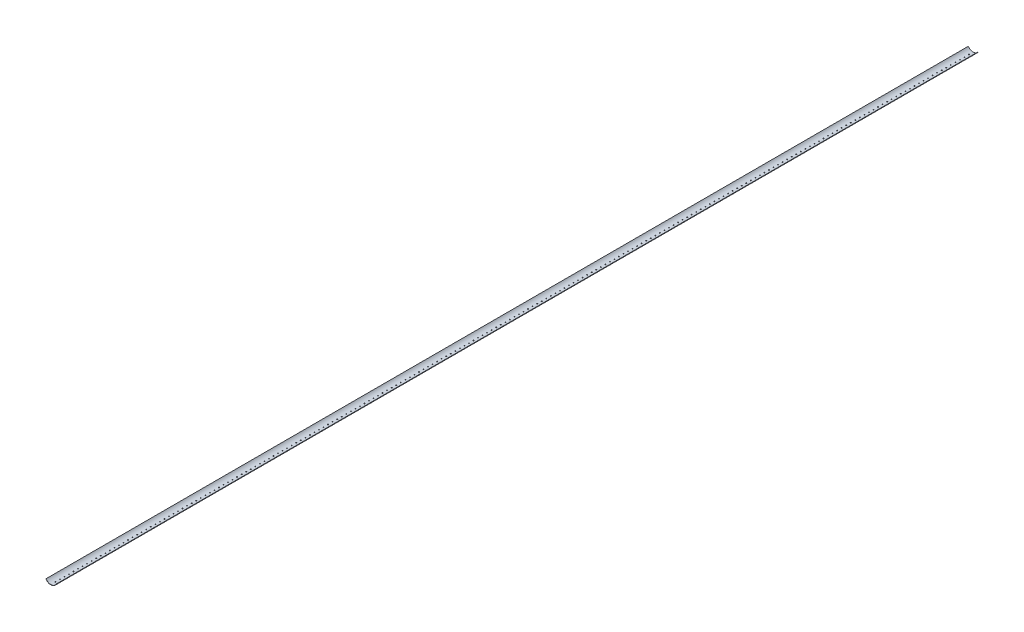
from build123d import *

# Parameters (mm, degrees)
BOSS_EXTRUDE3_DEPTH = 2743.2
SKETCH5_R           = 1.25
CUT_EXTRUDE1_DEPTH  = 10
LPATTERN2_COUNT     = 203
LPATTERN2_PITCH     = 13.52


with BuildPart() as part:
    # Sketch3 → Boss-Extrude3 (new body)
    with BuildSketch(Plane.XY):
        with BuildLine():
            Line((28.89, 0.001), (28.89, 0.994505052))
            ThreePointArc((28.89, 0.994505052), (14.445, -6.815360738), (0, 0.994505052))
            Line((0, 0.994505052), (0, 0.001))
            ThreePointArc((0, 0.001), (14.445, -7.81180068), (28.89, 0.001))
        make_face()
    extrude(amount=BOSS_EXTRUDE3_DEPTH)

    # Sketch5 → Cut-Extrude1 (cut)
    with BuildSketch(Plane(origin=(0, 0, 0), x_dir=(1, 0, 0), z_dir=(0, 1, 0))):
        with Locations(Location((14.445, -12.337805126, 0), (0, 0, 270))):
            Circle(SKETCH5_R)
    cut_extrude1 = extrude(amount=-CUT_EXTRUDE1_DEPTH, mode=Mode.SUBTRACT)

    # LPattern2: Cut-Extrude1 ×203
    with Locations(*[(0, 0, i * LPATTERN2_PITCH) for i in range(1, LPATTERN2_COUNT)]):
        add(cut_extrude1, mode=Mode.SUBTRACT)


solid = part.part
